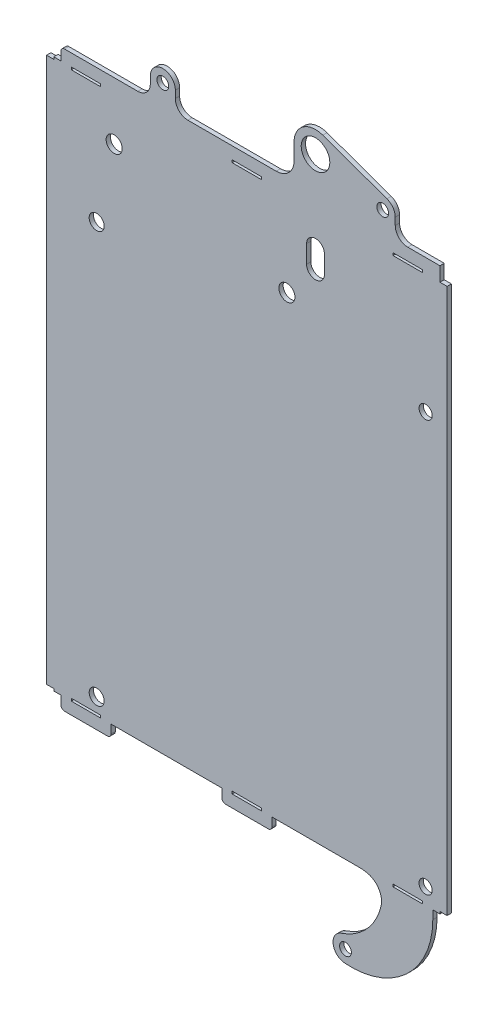
from build123d import *

# Parameters (mm, degrees)
SKETCH2_W           = 112.00010125
SKETCH2_H           = 190.5995575
SKETCH2_R           = 2.1
SKETCH2_R_2         = 1.85
BOSS_EXTRUDE1_DEPTH = 1.2
SKETCH5_W           = 2
SKETCH5_H           = 37.6
SKETCH5_H_2         = 0.6
CUT_EXTRUDE2_DEPTH  = 247.246128205
CUT_EXTRUDE1_DEPTH  = 247.246128205
SKETCH9_W           = 14
SKETCH9_H           = 3.4
SKETCH9_W_2         = 8.5
BOSS_EXTRUDE5_DEPTH = 1.2
FILLET1_R           = 1
CUT_EXTRUDE4_REACH  = 248.246
SKETCH10_W          = 8.2
SKETCH10_H          = 0.7
SKETCH11_R          = 2.25
CUT_EXTRUDE5_DEPTH  = 247.246128205
BOSS_EXTRUDE6_DEPTH = 1.2
SKETCH13_R          = 1.635773904
CUT_EXTRUDE6_DEPTH  = 248.202612706
SKETCH15_W          = 166.29246115
SKETCH15_H          = 51.52086731
CUT_EXTRUDE7_DEPTH  = 10
SKETCH17_R          = 1.65
BOSS_EXTRUDE7_DEPTH = 1.2
BOSS_EXTRUDE8_START = -1.2
SKETCH18_R          = 1.65
BOSS_EXTRUDE8_DEPTH = 1.2
BOSS_EXTRUDE9_START = -1.2
SKETCH19_R          = 4
BOSS_EXTRUDE9_DEPTH = 1.2
FILLET3_R           = 5
FILLET8_R           = 10
FILLET10_R          = 5


with BuildPart() as part:
    # Sketch2 → Boss-Extrude1 (new body)
    with BuildSketch(Plane.XY):
        with Locations((50.167238625, 126.88082875)):
            Rectangle(SKETCH2_W, SKETCH2_H)
        with Locations((8.16763175, 151.180160625)):
            Circle(SKETCH2_R, mode=Mode.SUBTRACT)
        with Locations((100.1668405, 151.180160625)):
            Circle(SKETCH2_R_2, mode=Mode.SUBTRACT)
        with Locations((100.1668405, 36.181495)):
            Circle(SKETCH2_R_2, mode=Mode.SUBTRACT)
        with Locations((8.16763175, 36.181495)):
            Circle(SKETCH2_R, mode=Mode.SUBTRACT)
    extrude(amount=BOSS_EXTRUDE1_DEPTH)

    # Sketch5 → Cut-Extrude2 (cut, through all)
    with BuildSketch(Plane.XY.offset(1.2)):
        Polygon((-3.832812, 185.1806075), (6.667188, 185.1806075), (6.667188, 222.1806075), (-5.832812, 222.1806075), (-5.832812, 185.1806075), (-5.832812, 184.5806075), (-3.832812, 184.5806075), align=None)
        with Locations((105.16728925, 203.3806075)):
            Rectangle(SKETCH5_W, SKETCH5_H)
        with Locations((-4.832812, 31.88105)):
            Rectangle(SKETCH5_W, SKETCH5_H_2)
        with Locations((105.16728925, 31.88105)):
            Rectangle(SKETCH5_W, SKETCH5_H_2)
    extrude(amount=-CUT_EXTRUDE2_DEPTH, mode=Mode.SUBTRACT)

    # Sketch4 → Cut-Extrude1 (cut, through all)
    with BuildSketch(Plane.XY.offset(1.2)):
        with BuildLine():
            Line((55.16728925, 218.1806075), (98.16728925, 218.1806075))
            ThreePointArc((98.16728925, 218.1806075), (99.581502812, 217.594821062), (100.16728925, 216.1806075))
            Line((100.16728925, 216.1806075), (100.16728925, 192.1806075))
            ThreePointArc((100.16728925, 192.1806075), (99.581502812, 190.766393938), (98.16728925, 190.1806075))
            Line((98.16728925, 190.1806075), (55.16728925, 190.1806075))
            ThreePointArc((55.16728925, 190.1806075), (53.753075688, 190.766393938), (53.16728925, 192.1806075))
            Line((53.16728925, 192.1806075), (53.16728925, 216.1806075))
            ThreePointArc((53.16728925, 216.1806075), (53.753075688, 217.594821062), (55.16728925, 218.1806075))
        make_face()
    extrude(amount=-CUT_EXTRUDE1_DEPTH, mode=Mode.SUBTRACT)

    # Sketch9 → Boss-Extrude5 (add)
    with BuildSketch(Plane.XY.offset(1.2)):
        with Locations((5.167188, 29.88105)):
            Rectangle(SKETCH9_W, SKETCH9_H)
        with Locations((95.16728925, 29.88105)):
            Rectangle(SKETCH9_W, SKETCH9_H)
        with Locations((50.167238625, 29.88105)):
            Rectangle(SKETCH9_W, SKETCH9_H)
        with Locations((2.417188, 186.8806075)):
            Rectangle(SKETCH9_W_2, SKETCH9_H)
    extrude(amount=-BOSS_EXTRUDE5_DEPTH)

    # Fillet1
    fillet1_edges = [part.edges().sort_by_distance(p)[0] for p in [
        (102.16728925, 28.18105, 0.6),
        (88.16728925, 28.18105, 0.6),
        (57.167238625, 28.18105, 0.6),
        (43.167238625, 28.18105, 0.6),
        (12.167188, 28.18105, 0.6),
        (-1.832812, 28.18105, 0.6),
        (-1.832812, 188.5806075, 0.6),
    ]]
    fillet(fillet1_edges, radius=FILLET1_R)

    # Sketch10 → Cut-Extrude4 (cut, up to next)
    with BuildSketch(Plane.XY.offset(1.2), mode=Mode.PRIVATE) as cut_extrude4_sk1:
        with Locations((95.16728925, 31.93105)):
            Rectangle(SKETCH10_W, SKETCH10_H)
    cut_extrude4_tool1 = extrude(cut_extrude4_sk1.sketch, amount=-CUT_EXTRUDE4_REACH, mode=Mode.PRIVATE) & part.part
    # Sketch10 → Cut-Extrude4 (cut, up to next)
    with BuildSketch(Plane.XY.offset(1.2), mode=Mode.PRIVATE) as cut_extrude4_sk2:
        with Locations((50.167238625, 31.93105)):
            Rectangle(SKETCH10_W, SKETCH10_H)
    cut_extrude4_tool2 = extrude(cut_extrude4_sk2.sketch, amount=-CUT_EXTRUDE4_REACH, mode=Mode.PRIVATE) & part.part
    # Sketch10 → Cut-Extrude4 (cut, up to next)
    with BuildSketch(Plane.XY.offset(1.2), mode=Mode.PRIVATE) as cut_extrude4_sk3:
        with Locations((5.167188, 31.93105)):
            Rectangle(SKETCH10_W, SKETCH10_H)
    cut_extrude4_tool3 = extrude(cut_extrude4_sk3.sketch, amount=-CUT_EXTRUDE4_REACH, mode=Mode.PRIVATE) & part.part
    # Sketch10 → Cut-Extrude4 (cut, up to next)
    with BuildSketch(Plane.XY.offset(1.2), mode=Mode.PRIVATE) as cut_extrude4_sk4:
        with Locations((50.167238625, 184.8306075)):
            Rectangle(SKETCH10_W, SKETCH10_H)
    cut_extrude4_tool4 = extrude(cut_extrude4_sk4.sketch, amount=-CUT_EXTRUDE4_REACH, mode=Mode.PRIVATE) & part.part
    # Sketch10 → Cut-Extrude4 (cut, up to next)
    with BuildSketch(Plane.XY.offset(1.2), mode=Mode.PRIVATE) as cut_extrude4_sk5:
        with Locations((95.16728925, 184.8306075)):
            Rectangle(SKETCH10_W, SKETCH10_H)
    cut_extrude4_tool5 = extrude(cut_extrude4_sk5.sketch, amount=-CUT_EXTRUDE4_REACH, mode=Mode.PRIVATE) & part.part
    # Sketch10 → Cut-Extrude4 (cut, up to next)
    with BuildSketch(Plane.XY.offset(1.2), mode=Mode.PRIVATE) as cut_extrude4_sk6:
        with Locations((5.167188, 184.8306075)):
            Rectangle(SKETCH10_W, SKETCH10_H)
    cut_extrude4_tool6 = extrude(cut_extrude4_sk6.sketch, amount=-CUT_EXTRUDE4_REACH, mode=Mode.PRIVATE) & part.part
    add(cut_extrude4_tool1.solids().sort_by_distance((95.167289, 31.93105, 1.2))[0], mode=Mode.SUBTRACT)
    add(cut_extrude4_tool2.solids().sort_by_distance((50.167239, 31.93105, 1.2))[0], mode=Mode.SUBTRACT)
    add(cut_extrude4_tool3.solids().sort_by_distance((5.167188, 31.93105, 1.2))[0], mode=Mode.SUBTRACT)
    add(cut_extrude4_tool4.solids().sort_by_distance((50.167239, 184.830607, 1.2))[0], mode=Mode.SUBTRACT)
    add(cut_extrude4_tool5.solids().sort_by_distance((95.167289, 184.830607, 1.2))[0], mode=Mode.SUBTRACT)
    add(cut_extrude4_tool6.solids().sort_by_distance((5.167188, 184.830607, 1.2))[0], mode=Mode.SUBTRACT)

    # Sketch11 → Cut-Extrude5 (cut, through all)
    with BuildSketch(Plane.XY.offset(1.2)):
        with Locations((61.367697375, 160.67994375)):
            Circle(SKETCH11_R)
        with Locations((13.067697375, 172.47994375)):
            Circle(SKETCH11_R)
        with BuildLine():
            Line((71.867697375, 175.27994375), (71.867697375, 170.27994375))
            ThreePointArc((71.867697375, 170.27994375), (69.367697375, 167.77994375), (66.867697375, 170.27994375))
            Line((66.867697375, 170.27994375), (66.867697375, 175.27994375))
            ThreePointArc((66.867697375, 175.27994375), (69.367697375, 177.77994375), (71.867697375, 175.27994375))
        make_face()
    extrude(amount=-CUT_EXTRUDE5_DEPTH, mode=Mode.SUBTRACT)

    # Sketch12 → Boss-Extrude6 (add)
    with BuildSketch(Plane.XY.offset(1.2)):
        with BuildLine():
            Line((104.16728925, 222.1806075), (104.16728925, 213.7806075))
            ThreePointArc((104.16728925, 213.7806075), (108.36728925, 217.9806075), (104.16728925, 222.1806075))
        make_face()
    extrude(amount=-BOSS_EXTRUDE6_DEPTH)

    # Sketch13 → Cut-Extrude6 (cut, through all)
    with BuildSketch(Plane.XY.offset(1.2)):
        with Locations((104.16728925, 217.9806075)):
            Circle(SKETCH13_R)
        with Locations((47.16728925, 217.9806075)):
            Circle(SKETCH13_R)
        with Locations((10.667188, 217.9806075)):
            Circle(SKETCH13_R)
    extrude(amount=-CUT_EXTRUDE6_DEPTH, mode=Mode.SUBTRACT)

    # Sketch15 → Cut-Extrude7 (cut)
    with BuildSketch(Plane.XY.offset(1.2)):
        with Locations((89.813418575, 214.341041155)):
            Rectangle(SKETCH15_W, SKETCH15_H)
    extrude(amount=-CUT_EXTRUDE7_DEPTH, mode=Mode.SUBTRACT)

    # Sketch17 → Boss-Extrude7 (add)
    # profile 1 of 2: a face of its own
    with BuildSketch(Plane(origin=(0, 0, 0), x_dir=(-1, 0, 0), z_dir=(0, 0, -1))):
        with BuildLine():
            Line((-81.1668405, 188.5806075), (-95.1668405, 188.5806075))
            ThreePointArc((-95.1668405, 188.5806075), (-92.691966766, 189.605733766), (-91.6668405, 192.0806075))
            Line((-91.6668405, 192.0806075), (-91.6668405, 194.093254991))
            ThreePointArc((-91.6668405, 194.093254991), (-88.1668405, 197.593254991), (-84.6668405, 194.093254991))
            Line((-84.6668405, 194.093254991), (-84.6668405, 192.0806075))
            ThreePointArc((-84.6668405, 192.0806075), (-83.641714234, 189.605733766), (-81.1668405, 188.5806075))
        make_face()
        with Locations((-88.1668405, 194.093254991)):
            Circle(SKETCH17_R, mode=Mode.SUBTRACT)
    # profile 2 of 2: a face of its own
    with BuildSketch(Plane(origin=(0, 0, 0), x_dir=(-1, 0, 0), z_dir=(0, 0, -1))):
        with BuildLine():
            Line((-19.6668405, 188.5806075), (-33.6668405, 188.5806075))
            ThreePointArc((-33.6668405, 188.5806075), (-31.191966766, 189.605733766), (-30.1668405, 192.0806075))
            Line((-30.1668405, 192.0806075), (-30.1668405, 194.093254991))
            ThreePointArc((-30.1668405, 194.093254991), (-26.6668405, 197.593254991), (-23.1668405, 194.093254991))
            Line((-23.1668405, 194.093254991), (-23.1668405, 192.0806075))
            ThreePointArc((-23.1668405, 192.0806075), (-22.141714234, 189.605733766), (-19.6668405, 188.5806075))
        make_face()
        with Locations((-26.6668405, 194.093254991)):
            Circle(SKETCH17_R, mode=Mode.SUBTRACT)
    extrude(amount=-BOSS_EXTRUDE7_DEPTH)

    # Sketch18 → Boss-Extrude8 (add)
    with BuildSketch(Plane.XY.offset(1.2).offset(BOSS_EXTRUDE8_START)):
        with BuildLine():
            Line((89.16728925, 28.18105), (101.16728925, 28.18105))
            ThreePointArc((101.16728925, 28.18105), (101.874396031, 28.473943219), (102.16728925, 29.18105))
            ThreePointArc((102.16728925, 29.18105), (94.810709764, 12.373227692), (77.471885747, 6.374283268))
            ThreePointArc((77.471885747, 6.374283268), (74.292882483, 9.419749119), (76.639173718, 13.144778172))
            ThreePointArc((76.639173718, 13.144778172), (84.986182742, 19.306088457), (88.16728925, 29.18105))
            ThreePointArc((88.16728925, 29.18105), (88.460182469, 28.473943219), (89.16728925, 28.18105))
        make_face()
        with Locations((77.748285655, 9.844733678)):
            Circle(SKETCH18_R, mode=Mode.SUBTRACT)
    extrude(amount=BOSS_EXTRUDE8_DEPTH)

    # Sketch19 → Boss-Extrude9 (add)
    with BuildSketch(Plane.XY.offset(1.2).offset(BOSS_EXTRUDE9_START)):
        with BuildLine():
            Line((63.367697375, 188.5806075), (81.1668405, 188.5806075))
            ThreePointArc((81.1668405, 188.5806075), (83.641714234, 189.605733766), (84.6668405, 192.0806075))
            Line((84.6668405, 192.0806075), (84.6668405, 194.093254991))
            ThreePointArc((84.6668405, 194.093254991), (86.152024438, 196.955162788), (89.347135493, 197.388236588))
            Line((89.347135493, 197.388236588), (71.39106022, 203.820280323))
            ThreePointArc((71.39106022, 203.820280323), (65.913726984, 203.077868093), (63.367697375, 198.171740441))
            Line((63.367697375, 198.171740441), (63.367697375, 188.5806075))
        make_face()
        with Locations((69.367697375, 198.171740441)):
            Circle(SKETCH19_R, mode=Mode.SUBTRACT)
    extrude(amount=BOSS_EXTRUDE9_DEPTH)

    # Fillet3
    fillet3_edges = [part.edges().sort_by_distance(p)[0] for p in [
        (63.367697375, 188.5806075, 0.6),
    ]]
    fillet(fillet3_edges, radius=FILLET3_R)

    # Fillet8
    # the kernel refuses this fillet: 10 mm, written as the material it adds along each edge
    with BuildSketch(Plane(origin=(88.16728925, 31.58105, 1.2), x_dir=(0, -1, 0), z_dir=(0, 0, -1))) as fillet8_piece_1:
        with BuildLine():
            CenterArc((10, 6.499230724), FILLET8_R, 180, 40.535802111)
            Line((0, 6.499230724), (-0.2, 6.499230724))
            Line((-0.2, 6.499230724), (-0.2, 0))
            Line((-0.2, 0), (0, -0.2))
            ThreePointArc((0, -0.2), (1.2, -0.2), (2.248, -0.129984614))
            Line((2.248, -0.129984614), (2.4, 0))
        make_face()
    extrude(amount=1.2)

    # Fillet10
    fillet10_edges = [part.edges().sort_by_distance(p)[0] for p in [
        (88.16728925, 29.18105, 0.6),
    ]]
    fillet(fillet10_edges, radius=FILLET10_R)


solid = part.part
